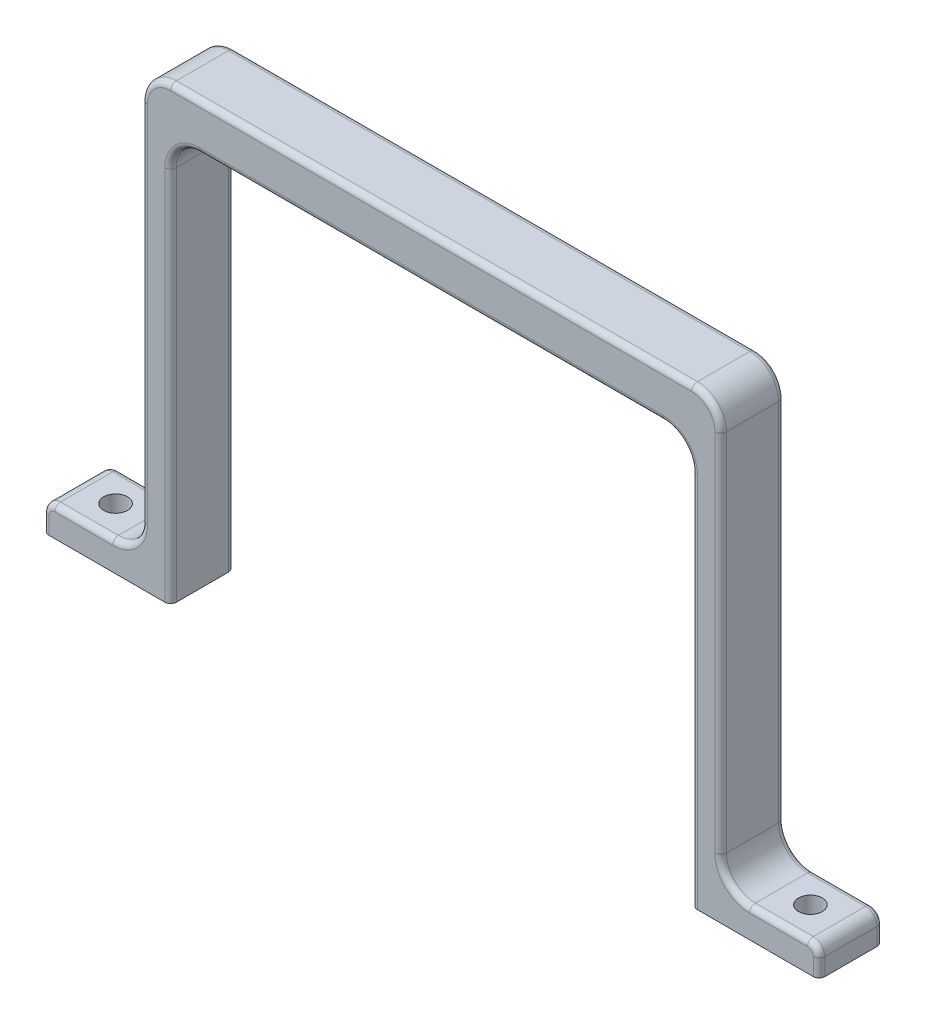
from build123d import *

# Parameters (mm, degrees)
BOSS_EXTRU_1_DEPTH      = 11
CONG_1_R                = 1
ESQUISSE2_R             = 3.2
ENL_V_MAT_EXTRU_1_DEPTH = 5
ESQUISSE3_R             = 2.05
ENL_V_MAT_EXTRU_2_DEPTH = 100.694533451


with BuildPart() as part:
    # Esquisse1 → Boss.-Extru.1 (new body)
    with BuildSketch(Plane.XY):
        with BuildLine():
            Line((-67, 0), (-45, 0))
            Line((-45, 0), (-45, 65))
            ThreePointArc((-45, 65), (-43.535533906, 68.535533906), (-40, 70))
            Line((-40, 70), (40, 70))
            ThreePointArc((40, 70), (43.535533906, 68.535533906), (45, 65))
            Line((45, 65), (45, 0))
            Line((45, 0), (67, 0))
            Line((67, 0), (67, 3))
            ThreePointArc((67, 3), (66.414213562, 4.414213562), (65, 5))
            Line((65, 5), (55, 5))
            ThreePointArc((55, 5), (51.464466094, 6.464466094), (50, 10))
            Line((50, 10), (50, 73))
            ThreePointArc((50, 73), (48.535533906, 76.535533906), (45, 78))
            Line((45, 78), (-45, 78))
            ThreePointArc((-45, 78), (-48.535533906, 76.535533906), (-50, 73))
            Line((-50, 73), (-50, 10))
            ThreePointArc((-50, 10), (-51.464466094, 6.464466094), (-55, 5))
            Line((-55, 5), (-65, 5))
            ThreePointArc((-65, 5), (-66.414213562, 4.414213562), (-67, 3))
            Line((-67, 3), (-67, 0))
        make_face()
    extrude(amount=BOSS_EXTRU_1_DEPTH)

    # Congé1
    cong_1_edges = [part.edges().sort_by_distance(p)[0] for p in [
        (45, 32.5, 11),
        (43.535533906, 68.535533906, 11),
        (0, 70, 11),
        (-43.535533906, 68.535533906, 11),
        (-45, 32.5, 0),
        (-43.535533906, 68.535533906, 0),
        (45, 32.5, 0),
        (43.535533906, 68.535533906, 0),
        (67, 1.5, 0),
        (66.414213562, 4.414213562, 0),
        (60, 5, 0),
        (51.464466094, 6.464466094, 0),
        (50, 41.5, 0),
        (48.535533906, 76.535533906, 0),
        (0, 78, 0),
        (-48.535533906, 76.535533906, 0),
        (-67, 1.5, 0),
        (-66.414213562, 4.414213562, 0),
        (-60, 5, 0),
        (-51.464466094, 6.464466094, 0),
        (67, 1.5, 11),
        (66.414213562, 4.414213562, 11),
        (60, 5, 11),
        (51.464466094, 6.464466094, 11),
        (50, 41.5, 11),
        (48.535533906, 76.535533906, 11),
        (-67, 1.5, 11),
        (-66.414213562, 4.414213562, 11),
        (-60, 5, 11),
        (-51.464466094, 6.464466094, 11),
        (-50, 41.5, 11),
        (-48.535533906, 76.535533906, 11),
        (-45, 32.5, 11),
        (0, 70, 0),
        (-50, 41.5, 0),
        (0, 78, 11),
    ]]
    fillet(cong_1_edges, radius=CONG_1_R)

    # Esquisse2 → Enlèv. mat.-Extru.1 (cut)
    with BuildSketch(Plane.XZ.offset(-70)):
        with Locations((-33.5, 5.5)):
            Circle(ESQUISSE2_R)
        with Locations((33.5, 5.5)):
            Circle(ESQUISSE2_R)
    extrude(amount=-ENL_V_MAT_EXTRU_1_DEPTH, mode=Mode.SUBTRACT)

    # Esquisse3 → Enlèv. mat.-Extru.2 (cut, through all)
    with BuildSketch(Plane(origin=(0, 5, 0), x_dir=(1, 0, 0), z_dir=(0, 1, 0))):
        with Locations((-60, -5.5)):
            Circle(ESQUISSE3_R)
        with Locations((60, -5.5)):
            Circle(ESQUISSE3_R)
    extrude(amount=-ENL_V_MAT_EXTRU_2_DEPTH, mode=Mode.SUBTRACT)


solid = part.part
